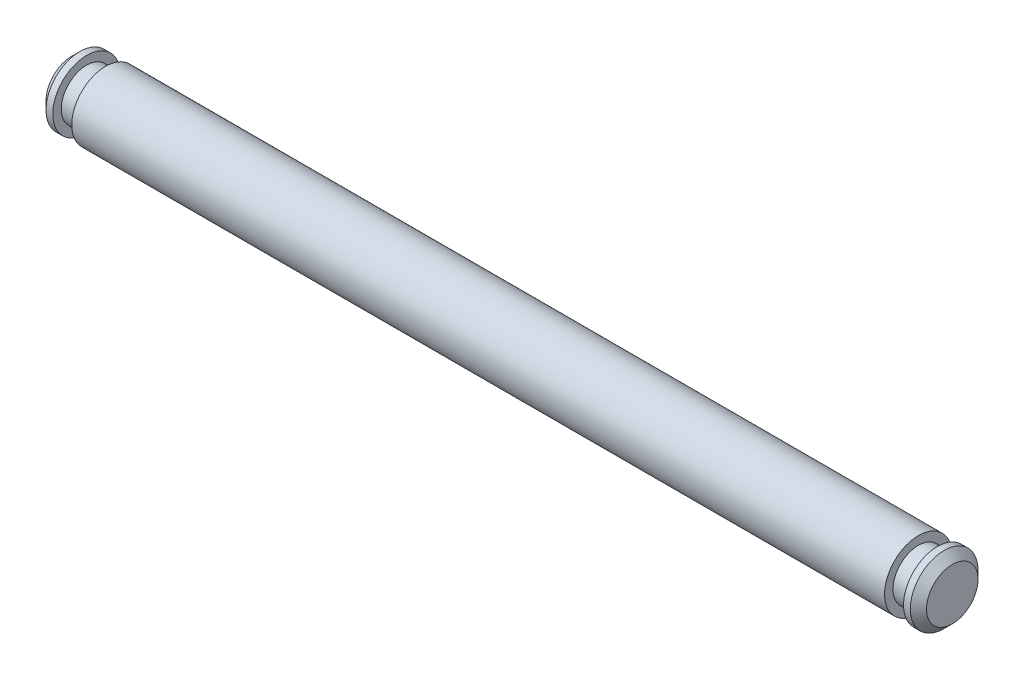
from build123d import *


with BuildPart() as part:
    # Sketch1 → Revolve1 (revolve)
    with BuildSketch(Plane.XY):
        Polygon((0, 0), (82.55, 0), (82.55, 2.413), (81.788, 3.175), (81.153, 3.175), (81.153, 2.38125), (79.375, 2.38125), (79.375, 3.175), (3.175, 3.175), (3.175, 2.38125), (1.397, 2.38125), (1.397, 3.175), (0.762, 3.175), (0, 2.413), align=None)
    revolve(axis=Axis((0, 0, 0), (-1, 0, 0)))


solid = part.part
